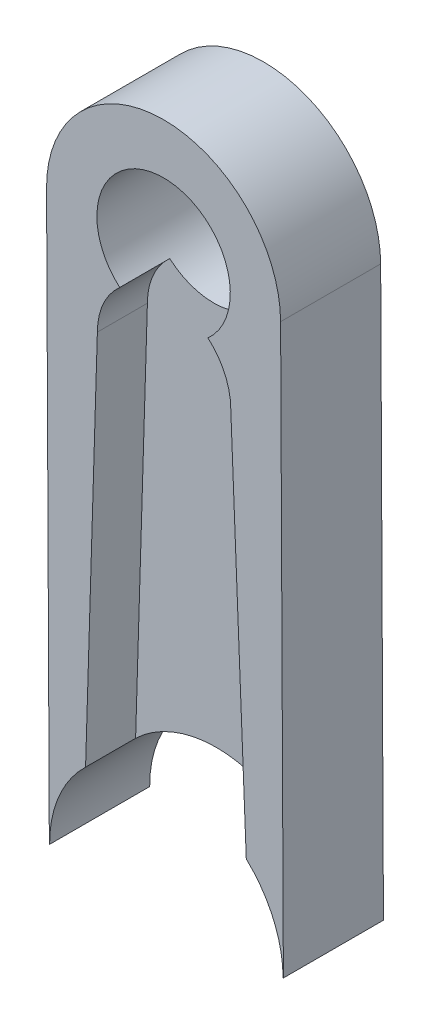
from build123d import *

# Parameters (mm, degrees)
BOSS_EXTRU_1_DEPTH = 3
BOSS_EXTRU_2_DEPTH = 1.5


# Read off the part's stored shape, not the designer's step: Boss.-Extru.1
with BuildPart() as part:
    # Boss.-Extru.1 outline → Boss.-Extru.1 (new body)
    with BuildSketch(Plane.XY):
        with BuildLine():
            Line((-2.42213609, 2.526510788), (-2.068537469, 14))
            ThreePointArc((-2.068537469, 14), (-1.893416293, 14.818423654), (-1.398720191, 15.493523995))
            ThreePointArc((-1.398720191, 15.493523995), (-0.093015019, 18.999976034), (1.246958654, 15.506476005))
            ThreePointArc((1.246958654, 15.506476005), (1.752312916, 14.827347495), (1.931462531, 14))
            Line((1.931462531, 14), (2.396407287, 2.550927696))
            ThreePointArc((2.396407287, 2.550927696), (3.208864051, 1.397566279), (3.49995806, 0.017134162))
            Line((3.49995806, 0.017134162), (3.508676576, 0.017176844))
            Line((3.508676576, 0.017176844), (3.425452507, 17.017176844))
            ThreePointArc((3.425452507, 17.017176844), (-0.100400913, 20.508676576), (-3.591900645, 16.982823156))
            Line((-3.591900645, 16.982823156), (-3.508676576, -0.017176844))
            Line((-3.508676576, -0.017176844), (-3.49995806, -0.017134162))
            ThreePointArc((-3.49995806, -0.017134162), (-3.222628149, 1.3655284), (-2.42213609, 2.526510788))
        make_face()
    extrude(amount=BOSS_EXTRU_1_DEPTH)

    # Esquisse1<5> → Boss.-Extru.2 (add)
    with BuildSketch(Plane.XY):
        with BuildLine():
            ThreePointArc((-2.065775424, 14.105074011), (-2.067846838, 14.052555154), (-2.068537469, 14))
            Line((-2.068537469, 14), (-1.902868639, 14))
            ThreePointArc((-1.902868639, 14), (-1.985047825, 14.051411734), (-2.065775424, 14.105074011))
        make_face()
        with BuildLine():
            Line((-1.902868639, 14), (-2.068537469, 14))
            ThreePointArc((-2.068537469, 14), (-0.068537469, 12), (1.931462531, 14))
            Line((1.931462531, 14), (1.7364205, 14))
            ThreePointArc((1.7364205, 14), (-0.083224069, 13.491281379), (-1.902868639, 14))
        make_face()
        with BuildLine():
            Line((1.7364205, 14), (1.931462531, 14))
            ThreePointArc((1.931462531, 14), (1.930490661, 14.062342092), (1.927575995, 14.124623596))
            ThreePointArc((1.927575995, 14.124623596), (1.833011637, 14.060757397), (1.7364205, 14))
        make_face()
        with BuildLine():
            ThreePointArc((-2.065775424, 14.105074011), (-1.985047825, 14.051411734), (-1.902868639, 14))
            Line((-1.902868639, 14), (1.7364205, 14))
            ThreePointArc((1.7364205, 14), (1.833011637, 14.060757397), (1.927575995, 14.124623596))
            ThreePointArc((1.927575995, 14.124623596), (1.725638814, 14.88370327), (1.246958654, 15.506476005))
            ThreePointArc((1.246958654, 15.506476005), (-0.073433119, 15.000023966), (-1.398720191, 15.493523995))
            ThreePointArc((-1.398720191, 15.493523995), (-1.871279944, 14.866094433), (-2.065775424, 14.105074011))
        make_face()
        with BuildLine():
            Line((1.7364205, 14), (-1.902868639, 14))
            ThreePointArc((-1.902868639, 14), (-0.083224069, 13.491281379), (1.7364205, 14))
        make_face()
        with BuildLine():
            Line((-2.068537469, 14), (-2.42213609, 2.526510788))
            ThreePointArc((-2.42213609, 2.526510788), (-0.017735252, 3.499955066), (2.396407287, 2.550927696))
            Line((2.396407287, 2.550927696), (1.931462531, 14))
            ThreePointArc((1.931462531, 14), (-0.068537469, 12), (-2.068537469, 14))
        make_face()
    extrude(amount=BOSS_EXTRU_2_DEPTH)


solid = part.part
